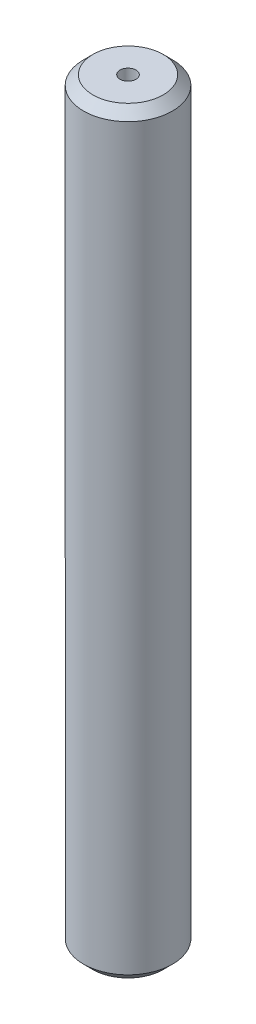
from build123d import *

# Parameters (mm, degrees)
SKETCH1_R           = 5
BOSS_EXTRUDE1_DEPTH = 85.230383133
SKETCH2_R           = 0.900166224
CUT_EXTRUDE1_DEPTH  = 86.523202752
CHAMFER1_SIZE       = 1.047946488


with BuildPart() as part:
    # Sketch1 → Boss-Extrude1 (new body)
    with BuildSketch(Plane(origin=(0, 0, 0), x_dir=(1, 0, 0), z_dir=(0, 1, 0))):
        Circle(SKETCH1_R)
    extrude(amount=BOSS_EXTRUDE1_DEPTH)

    # Sketch2 → Cut-Extrude1 (cut, through all)
    with BuildSketch(Plane(origin=(0, 0, 0), x_dir=(1, 0, 0), z_dir=(0, 1, 0))):
        Circle(SKETCH2_R)
    extrude(amount=CUT_EXTRUDE1_DEPTH, mode=Mode.SUBTRACT)

    # Chamfer1
    chamfer1_edges = [part.edges().sort_by_distance(p)[0] for p in [
        (-5, 85.230383133, 0),
        (-5, 0, 0),
    ]]
    chamfer(chamfer1_edges, length=CHAMFER1_SIZE)


solid = part.part
